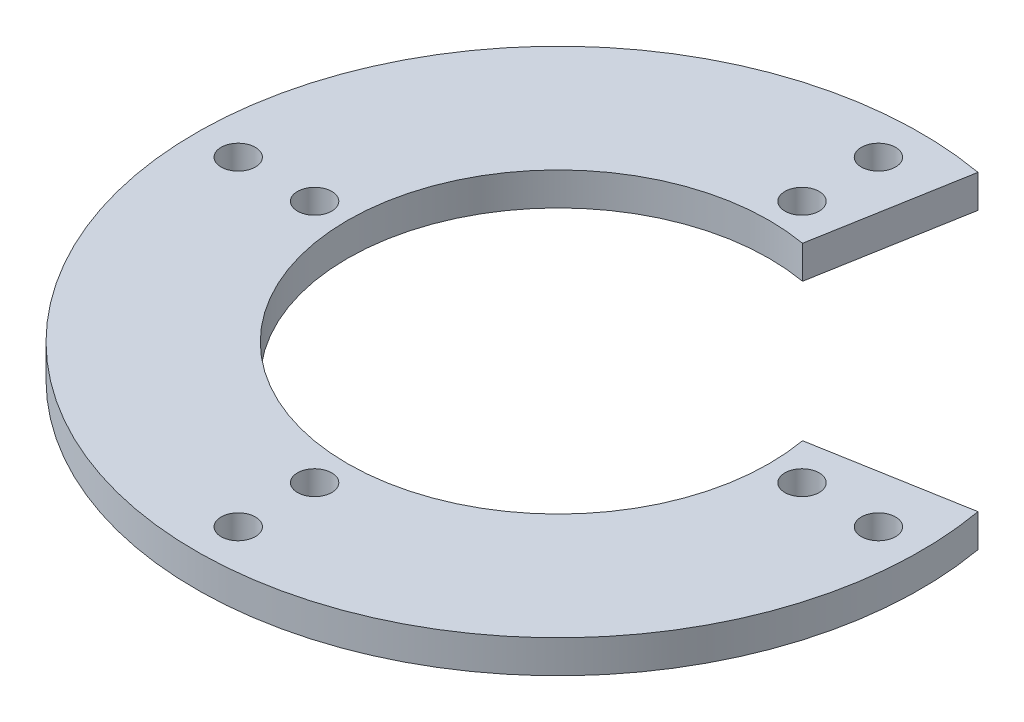
from build123d import *

# Parameters (mm, degrees)
SKETCH1_R           = 1.3
BOSS_EXTRUDE1_DEPTH = 2.5


with BuildPart() as part:
    # Sketch1 → Boss-Extrude1 (new body)
    with BuildSketch(Plane(origin=(0, 0, 0), x_dir=(1, 0, 0), z_dir=(0, 1, 0))):
        with BuildLine():
            ThreePointArc((16, 0), (-12.25671109, -10.284601755), (2.778370843, 15.756924048))
            Line((2.778370843, 15.756924048), (4.775324886, 27.082213208))
            ThreePointArc((4.775324886, 27.082213208), (-21.066222186, -17.676659266), (27.5, 0))
            ThreePointArc((27.5, 0), (27.395354198, 2.396782926), (27.082213208, 4.775324886))
            Line((27.082213208, 4.775324886), (15.756924048, 2.778370843))
            ThreePointArc((15.756924048, 2.778370843), (15.939115169, 1.394491884), (16, 0))
        make_face()
        with Locations((0, -24.3)):
            Circle(SKETCH1_R, mode=Mode.SUBTRACT)
        with Locations((0, -18.5)):
            Circle(SKETCH1_R, mode=Mode.SUBTRACT)
        with Locations((-24.3, 0)):
            Circle(SKETCH1_R, mode=Mode.SUBTRACT)
        with Locations((-18.5, 0)):
            Circle(SKETCH1_R, mode=Mode.SUBTRACT)
        with Locations((0, 18.5)):
            Circle(SKETCH1_R, mode=Mode.SUBTRACT)
        with Locations((18.5, 0)):
            Circle(SKETCH1_R, mode=Mode.SUBTRACT)
        with Locations((24.3, 0)):
            Circle(SKETCH1_R, mode=Mode.SUBTRACT)
        with Locations((0, 24.3)):
            Circle(SKETCH1_R, mode=Mode.SUBTRACT)
    extrude(amount=BOSS_EXTRUDE1_DEPTH)


solid = part.part
